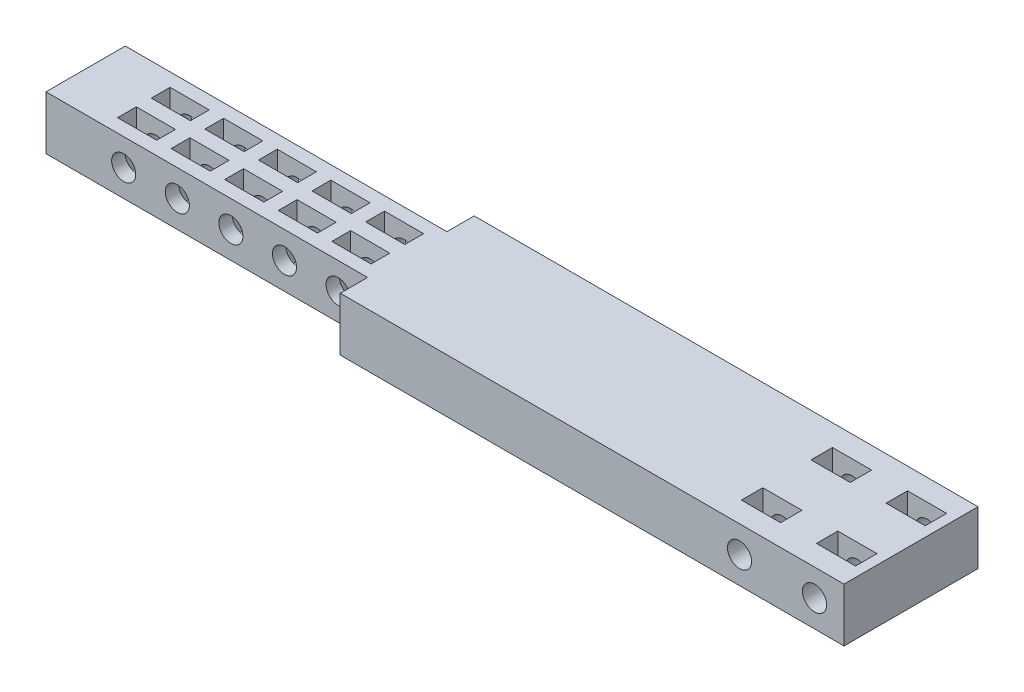
from build123d import *

# Parameters (mm, degrees)
SKETCH1_W              = 250
SKETCH1_H              = 25
BOSS_EXTRUDE1_DEPTH    = 10
CUT_EXTRUDE1_REACH     = 253.446
SKETCH2_R              = 2.15
FILLET1_R              = 12.5
SKETCH3_R              = 2.25
CUT_EXTRUDE2_DEPTH     = 252.445819214
CUT_EXTRUDE5_REACH     = 253.446
SKETCH5_W              = 7.3
SKETCH5_H              = 4
SKETCH6_R              = 10
CUT_EXTRUDE6_DEPTH     = 5
CUT_EXTRUDE7_REACH     = 253.297
SKETCH7_R              = 1.65
CUT_EXTRUDE8_START     = -3.2
CUT_EXTRUDE8_OUTLINE_W = 6
CUT_EXTRUDE8_OUTLINE_H = 6
CUT_EXTRUDE8_DEPTH     = 6.4
SKETCH9_R              = 3
CUT_EXTRUDE9_DEPTH     = 2
CUT_EXTRUDE10_REACH    = 253.446
SKETCH10_W             = 60
SKETCH10_H             = 5.1
SKETCH10_W_2           = 7.3
SKETCH10_H_2           = 3.5
SKETCH11_R             = 2.25
CUT_EXTRUDE11_DEPTH    = 251.990059564


# Read off the part's stored shape, not the designer's step: Cut-Extrude8
with BuildPart() as part:
    # Sketch1 → Boss-Extrude1 (new body)
    with BuildSketch(Plane(origin=(0, 0, 0), x_dir=(1, 0, 0), z_dir=(0, 1, 0))):
        with Locations((125, 12.5)):
            Rectangle(SKETCH1_W, SKETCH1_H)
    extrude(amount=BOSS_EXTRUDE1_DEPTH)

    # Sketch2 → Cut-Extrude1 (cut, up to next)
    with BuildSketch(Plane(origin=(0, 10, 0), x_dir=(1, 0, 0), z_dir=(0, 1, 0)), mode=Mode.PRIVATE) as cut_extrude1_sk1:
        with Locations(Location((12.5, 12.5, 0), (0, 0, 270))):
            Circle(SKETCH2_R)
    cut_extrude1_tool1 = extrude(cut_extrude1_sk1.sketch, amount=-CUT_EXTRUDE1_REACH, mode=Mode.PRIVATE) & part.part
    add(cut_extrude1_tool1.solids().sort_by_distance((12.5, 10, -12.5))[0], mode=Mode.SUBTRACT)

    # Fillet1
    fillet1_edges = [part.edges().sort_by_distance(p)[0] for p in [
        (0, 5, 0),
        (0, 5, -25),
    ]]
    fillet(fillet1_edges, radius=FILLET1_R - 0.0001)  # a hair under: the kernel refuses the full size

    # Sketch3 → Cut-Extrude2 (cut, through all)
    with BuildSketch(Plane(origin=(0, 0, -25), x_dir=(-1, 0, 0), z_dir=(0, 0, -1))):
        with Locations((-244.5, 5)):
            Circle(SKETCH3_R)
        with Locations((-230.5, 5)):
            Circle(SKETCH3_R)
    extrude(amount=-CUT_EXTRUDE2_DEPTH, mode=Mode.SUBTRACT)

    # Sketch5 → Cut-Extrude5 (cut, up to next)
    with BuildSketch(Plane(origin=(0, 10, 0), x_dir=(1, 0, 0), z_dir=(0, 1, 0)), mode=Mode.PRIVATE) as cut_extrude5_sk1:
        with Locations((244.5, 19)):
            Rectangle(SKETCH5_W, SKETCH5_H)
    cut_extrude5_tool1 = extrude(cut_extrude5_sk1.sketch, amount=-CUT_EXTRUDE5_REACH, mode=Mode.PRIVATE) & part.part
    # Sketch5 → Cut-Extrude5 (cut, up to next)
    with BuildSketch(Plane(origin=(0, 10, 0), x_dir=(1, 0, 0), z_dir=(0, 1, 0)), mode=Mode.PRIVATE) as cut_extrude5_sk2:
        with Locations((244.5, 6)):
            Rectangle(SKETCH5_W, SKETCH5_H)
    cut_extrude5_tool2 = extrude(cut_extrude5_sk2.sketch, amount=-CUT_EXTRUDE5_REACH, mode=Mode.PRIVATE) & part.part
    # Sketch5 → Cut-Extrude5 (cut, up to next)
    with BuildSketch(Plane(origin=(0, 10, 0), x_dir=(1, 0, 0), z_dir=(0, 1, 0)), mode=Mode.PRIVATE) as cut_extrude5_sk3:
        with Locations((230.5, 19)):
            Rectangle(SKETCH5_W, SKETCH5_H)
    cut_extrude5_tool3 = extrude(cut_extrude5_sk3.sketch, amount=-CUT_EXTRUDE5_REACH, mode=Mode.PRIVATE) & part.part
    # Sketch5 → Cut-Extrude5 (cut, up to next)
    with BuildSketch(Plane(origin=(0, 10, 0), x_dir=(1, 0, 0), z_dir=(0, 1, 0)), mode=Mode.PRIVATE) as cut_extrude5_sk4:
        with Locations((230.5, 6)):
            Rectangle(SKETCH5_W, SKETCH5_H)
    cut_extrude5_tool4 = extrude(cut_extrude5_sk4.sketch, amount=-CUT_EXTRUDE5_REACH, mode=Mode.PRIVATE) & part.part
    add(cut_extrude5_tool1.solids().sort_by_distance((244.5, 10, -19))[0], mode=Mode.SUBTRACT)
    add(cut_extrude5_tool2.solids().sort_by_distance((244.5, 10, -6))[0], mode=Mode.SUBTRACT)
    add(cut_extrude5_tool3.solids().sort_by_distance((230.5, 10, -19))[0], mode=Mode.SUBTRACT)
    add(cut_extrude5_tool4.solids().sort_by_distance((230.5, 10, -6))[0], mode=Mode.SUBTRACT)

    # Sketch6 → Cut-Extrude6 (cut)
    with BuildSketch(Plane.XZ):
        with Locations(Location((12.5, -12.5, 0), (0, 0, 270))):
            Circle(SKETCH6_R)
    extrude(amount=-CUT_EXTRUDE6_DEPTH, mode=Mode.SUBTRACT)

    # Sketch7 → Cut-Extrude7 (cut, up to next)
    with BuildSketch(Plane.XZ.offset(-5), mode=Mode.PRIVATE) as cut_extrude7_sk1:
        with Locations(Location((12.5, -6, 0), (0, 0, 270))):
            Circle(SKETCH7_R)
    cut_extrude7_tool1 = extrude(cut_extrude7_sk1.sketch, amount=-CUT_EXTRUDE7_REACH, mode=Mode.PRIVATE) & part.part
    # Sketch7 → Cut-Extrude7 (cut, up to next)
    with BuildSketch(Plane.XZ.offset(-5), mode=Mode.PRIVATE) as cut_extrude7_sk2:
        with Locations(Location((19, -12.5, 0), (0, 0, 270))):
            Circle(SKETCH7_R)
    cut_extrude7_tool2 = extrude(cut_extrude7_sk2.sketch, amount=-CUT_EXTRUDE7_REACH, mode=Mode.PRIVATE) & part.part
    # Sketch7 → Cut-Extrude7 (cut, up to next)
    with BuildSketch(Plane.XZ.offset(-5), mode=Mode.PRIVATE) as cut_extrude7_sk3:
        with Locations(Location((12.5, -19, 0), (0, 0, 270))):
            Circle(SKETCH7_R)
    cut_extrude7_tool3 = extrude(cut_extrude7_sk3.sketch, amount=-CUT_EXTRUDE7_REACH, mode=Mode.PRIVATE) & part.part
    # Sketch7 → Cut-Extrude7 (cut, up to next)
    with BuildSketch(Plane.XZ.offset(-5), mode=Mode.PRIVATE) as cut_extrude7_sk4:
        with Locations(Location((6, -12.5, 0), (0, 0, 270))):
            Circle(SKETCH7_R)
    cut_extrude7_tool4 = extrude(cut_extrude7_sk4.sketch, amount=-CUT_EXTRUDE7_REACH, mode=Mode.PRIVATE) & part.part
    add(cut_extrude7_tool1.solids().sort_by_distance((12.5, 5, -6))[0], mode=Mode.SUBTRACT)
    add(cut_extrude7_tool2.solids().sort_by_distance((19, 5, -12.5))[0], mode=Mode.SUBTRACT)
    add(cut_extrude7_tool3.solids().sort_by_distance((12.5, 5, -19))[0], mode=Mode.SUBTRACT)
    add(cut_extrude7_tool4.solids().sort_by_distance((6, 5, -12.5))[0], mode=Mode.SUBTRACT)

    # Cut-Extrude8 outline → Cut-Extrude8 (cut)
    with BuildSketch(Plane(origin=(0, 0, 0), x_dir=(0.707106781186548, 0, -0.707106781186547), z_dir=(0.707106781186547, 0, 0.707106781186548)).offset(CUT_EXTRUDE8_START)):
        with Locations((7, 2)):
            Rectangle(CUT_EXTRUDE8_OUTLINE_W, CUT_EXTRUDE8_OUTLINE_H)
    extrude(amount=CUT_EXTRUDE8_DEPTH, mode=Mode.SUBTRACT)

    # Sketch9 → Cut-Extrude9 (cut)
    with BuildSketch(Plane(origin=(0, 10, 0), x_dir=(1, 0, 0), z_dir=(0, 1, 0))):
        with Locations(Location((12.5, 19, 0), (0, 0, 270))):
            Circle(SKETCH9_R)
        with Locations(Location((19, 12.5, 0), (0, 0, 270))):
            Circle(SKETCH9_R)
        with Locations(Location((12.5, 6, 0), (0, 0, 270))):
            Circle(SKETCH9_R)
        with Locations(Location((6, 12.5, 0), (0, 0, 270))):
            Circle(SKETCH9_R)
    extrude(amount=-CUT_EXTRUDE9_DEPTH, mode=Mode.SUBTRACT)

    # Sketch10 → Cut-Extrude10 (cut, up to next)
    with BuildSketch(Plane(origin=(0, 10, 0), x_dir=(1, 0, 0), z_dir=(0, 1, 0)), mode=Mode.PRIVATE) as cut_extrude10_sk1:
        Polygon((0, 25), (0, 0), (96, 0), (96, 5.1), (96, 19.9), (96, 25), align=None)
    cut_extrude10_tool1 = extrude(cut_extrude10_sk1.sketch, amount=-CUT_EXTRUDE10_REACH, mode=Mode.PRIVATE) & part.part
    # Sketch10 → Cut-Extrude10 (cut, up to next)
    with BuildSketch(Plane(origin=(0, 10, 0), x_dir=(1, 0, 0), z_dir=(0, 1, 0)), mode=Mode.PRIVATE) as cut_extrude10_sk2:
        with Locations((126, 2.55)):
            Rectangle(SKETCH10_W, SKETCH10_H)
    cut_extrude10_tool2 = extrude(cut_extrude10_sk2.sketch, amount=-CUT_EXTRUDE10_REACH, mode=Mode.PRIVATE) & part.part
    # Sketch10 → Cut-Extrude10 (cut, up to next)
    with BuildSketch(Plane(origin=(0, 10, 0), x_dir=(1, 0, 0), z_dir=(0, 1, 0)), mode=Mode.PRIVATE) as cut_extrude10_sk3:
        with Locations((126, 22.45)):
            Rectangle(SKETCH10_W, SKETCH10_H)
    cut_extrude10_tool3 = extrude(cut_extrude10_sk3.sketch, amount=-CUT_EXTRUDE10_REACH, mode=Mode.PRIVATE) & part.part
    # Sketch10 → Cut-Extrude10 (cut, up to next)
    with BuildSketch(Plane(origin=(0, 10, 0), x_dir=(1, 0, 0), z_dir=(0, 1, 0)), mode=Mode.PRIVATE) as cut_extrude10_sk4:
        with Locations((140.5, 15.65)):
            Rectangle(SKETCH10_W_2, SKETCH10_H_2)
    cut_extrude10_tool4 = extrude(cut_extrude10_sk4.sketch, amount=-CUT_EXTRUDE10_REACH, mode=Mode.PRIVATE) & part.part
    # Sketch10 → Cut-Extrude10 (cut, up to next)
    with BuildSketch(Plane(origin=(0, 10, 0), x_dir=(1, 0, 0), z_dir=(0, 1, 0)), mode=Mode.PRIVATE) as cut_extrude10_sk5:
        with Locations((150.5, 15.65)):
            Rectangle(SKETCH10_W_2, SKETCH10_H_2)
    cut_extrude10_tool5 = extrude(cut_extrude10_sk5.sketch, amount=-CUT_EXTRUDE10_REACH, mode=Mode.PRIVATE) & part.part
    # Sketch10 → Cut-Extrude10 (cut, up to next)
    with BuildSketch(Plane(origin=(0, 10, 0), x_dir=(1, 0, 0), z_dir=(0, 1, 0)), mode=Mode.PRIVATE) as cut_extrude10_sk6:
        with Locations((130.5, 15.65)):
            Rectangle(SKETCH10_W_2, SKETCH10_H_2)
    cut_extrude10_tool6 = extrude(cut_extrude10_sk6.sketch, amount=-CUT_EXTRUDE10_REACH, mode=Mode.PRIVATE) & part.part
    # Sketch10 → Cut-Extrude10 (cut, up to next)
    with BuildSketch(Plane(origin=(0, 10, 0), x_dir=(1, 0, 0), z_dir=(0, 1, 0)), mode=Mode.PRIVATE) as cut_extrude10_sk7:
        with Locations((120.5, 15.65)):
            Rectangle(SKETCH10_W_2, SKETCH10_H_2)
    cut_extrude10_tool7 = extrude(cut_extrude10_sk7.sketch, amount=-CUT_EXTRUDE10_REACH, mode=Mode.PRIVATE) & part.part
    # Sketch10 → Cut-Extrude10 (cut, up to next)
    with BuildSketch(Plane(origin=(0, 10, 0), x_dir=(1, 0, 0), z_dir=(0, 1, 0)), mode=Mode.PRIVATE) as cut_extrude10_sk8:
        with Locations((110.5, 15.65)):
            Rectangle(SKETCH10_W_2, SKETCH10_H_2)
    cut_extrude10_tool8 = extrude(cut_extrude10_sk8.sketch, amount=-CUT_EXTRUDE10_REACH, mode=Mode.PRIVATE) & part.part
    # Sketch10 → Cut-Extrude10 (cut, up to next)
    with BuildSketch(Plane(origin=(0, 10, 0), x_dir=(1, 0, 0), z_dir=(0, 1, 0)), mode=Mode.PRIVATE) as cut_extrude10_sk9:
        with Locations((150.5, 9.35)):
            Rectangle(SKETCH10_W_2, SKETCH10_H_2)
    cut_extrude10_tool9 = extrude(cut_extrude10_sk9.sketch, amount=-CUT_EXTRUDE10_REACH, mode=Mode.PRIVATE) & part.part
    # Sketch10 → Cut-Extrude10 (cut, up to next)
    with BuildSketch(Plane(origin=(0, 10, 0), x_dir=(1, 0, 0), z_dir=(0, 1, 0)), mode=Mode.PRIVATE) as cut_extrude10_sk10:
        with Locations((140.5, 9.35)):
            Rectangle(SKETCH10_W_2, SKETCH10_H_2)
    cut_extrude10_tool10 = extrude(cut_extrude10_sk10.sketch, amount=-CUT_EXTRUDE10_REACH, mode=Mode.PRIVATE) & part.part
    # Sketch10 → Cut-Extrude10 (cut, up to next)
    with BuildSketch(Plane(origin=(0, 10, 0), x_dir=(1, 0, 0), z_dir=(0, 1, 0)), mode=Mode.PRIVATE) as cut_extrude10_sk11:
        with Locations((130.5, 9.35)):
            Rectangle(SKETCH10_W_2, SKETCH10_H_2)
    cut_extrude10_tool11 = extrude(cut_extrude10_sk11.sketch, amount=-CUT_EXTRUDE10_REACH, mode=Mode.PRIVATE) & part.part
    # Sketch10 → Cut-Extrude10 (cut, up to next)
    with BuildSketch(Plane(origin=(0, 10, 0), x_dir=(1, 0, 0), z_dir=(0, 1, 0)), mode=Mode.PRIVATE) as cut_extrude10_sk12:
        with Locations((120.5, 9.35)):
            Rectangle(SKETCH10_W_2, SKETCH10_H_2)
    cut_extrude10_tool12 = extrude(cut_extrude10_sk12.sketch, amount=-CUT_EXTRUDE10_REACH, mode=Mode.PRIVATE) & part.part
    # Sketch10 → Cut-Extrude10 (cut, up to next)
    with BuildSketch(Plane(origin=(0, 10, 0), x_dir=(1, 0, 0), z_dir=(0, 1, 0)), mode=Mode.PRIVATE) as cut_extrude10_sk13:
        with Locations((110.5, 9.35)):
            Rectangle(SKETCH10_W_2, SKETCH10_H_2)
    cut_extrude10_tool13 = extrude(cut_extrude10_sk13.sketch, amount=-CUT_EXTRUDE10_REACH, mode=Mode.PRIVATE) & part.part
    add(cut_extrude10_tool1.solids().sort_by_distance((48, 10, -12.5))[0], mode=Mode.SUBTRACT)
    add(cut_extrude10_tool2.solids().sort_by_distance((126, 10, -2.55))[0], mode=Mode.SUBTRACT)
    add(cut_extrude10_tool3.solids().sort_by_distance((126, 10, -22.45))[0], mode=Mode.SUBTRACT)
    add(cut_extrude10_tool4.solids().sort_by_distance((140.5, 10, -15.65))[0], mode=Mode.SUBTRACT)
    add(cut_extrude10_tool5.solids().sort_by_distance((150.5, 10, -15.65))[0], mode=Mode.SUBTRACT)
    add(cut_extrude10_tool6.solids().sort_by_distance((130.5, 10, -15.65))[0], mode=Mode.SUBTRACT)
    add(cut_extrude10_tool7.solids().sort_by_distance((120.5, 10, -15.65))[0], mode=Mode.SUBTRACT)
    add(cut_extrude10_tool8.solids().sort_by_distance((110.5, 10, -15.65))[0], mode=Mode.SUBTRACT)
    add(cut_extrude10_tool9.solids().sort_by_distance((150.5, 10, -9.35))[0], mode=Mode.SUBTRACT)
    add(cut_extrude10_tool10.solids().sort_by_distance((140.5, 10, -9.35))[0], mode=Mode.SUBTRACT)
    add(cut_extrude10_tool11.solids().sort_by_distance((130.5, 10, -9.35))[0], mode=Mode.SUBTRACT)
    add(cut_extrude10_tool12.solids().sort_by_distance((120.5, 10, -9.35))[0], mode=Mode.SUBTRACT)
    add(cut_extrude10_tool13.solids().sort_by_distance((110.5, 10, -9.35))[0], mode=Mode.SUBTRACT)

    # Sketch11 → Cut-Extrude11 (cut, through all)
    with BuildSketch(Plane(origin=(0, 0, -19.9), x_dir=(-1, 0, 0), z_dir=(0, 0, -1))):
        with Locations((-150.5, 5)):
            Circle(SKETCH11_R)
        with Locations(Location((-140.5, 5, 0), (0, 0, 180))):
            Circle(SKETCH11_R)
        with Locations((-130.5, 5)):
            Circle(SKETCH11_R)
        with Locations(Location((-120.5, 5, 0), (0, 0, 180))):
            Circle(SKETCH11_R)
        with Locations(Location((-110.5, 5, 0), (0, 0, 180))):
            Circle(SKETCH11_R)
    extrude(amount=-CUT_EXTRUDE11_DEPTH, mode=Mode.SUBTRACT)


solid = part.part
